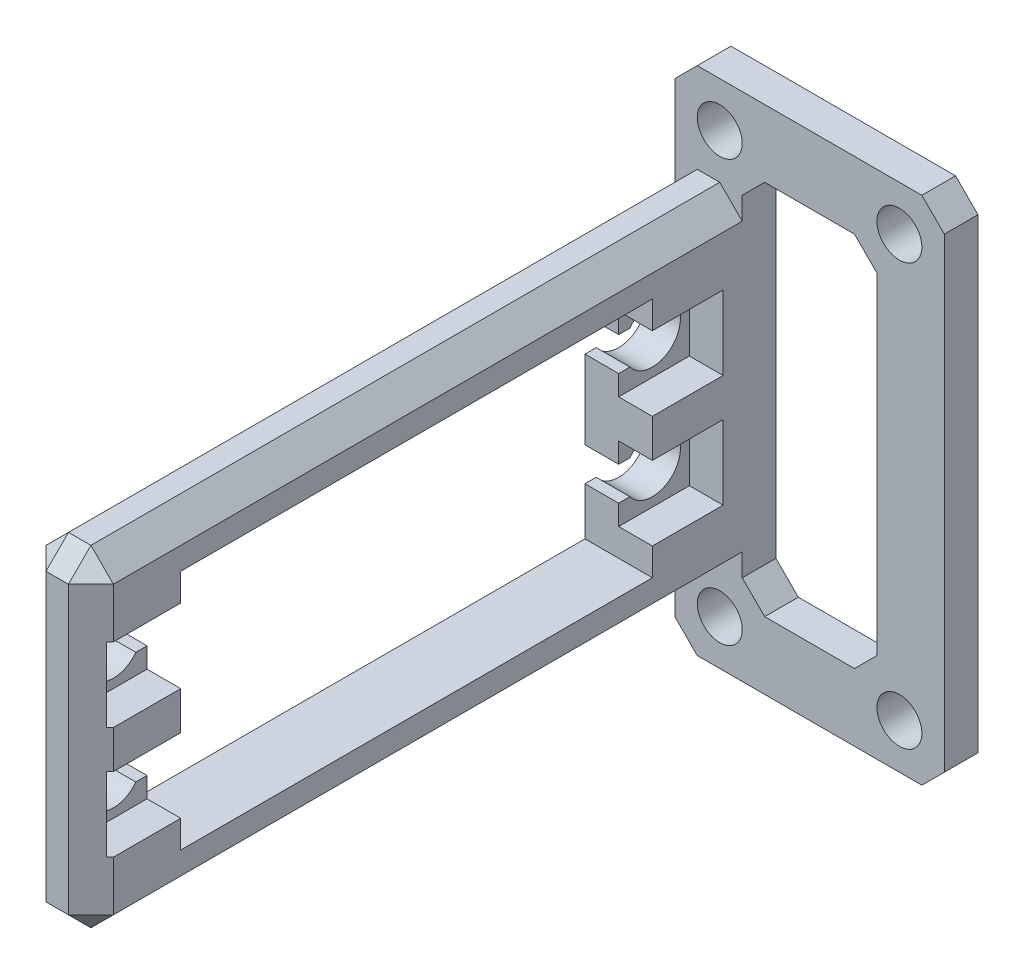
from build123d import *

# Parameters (mm, degrees)
SKETCH1_W           = 58
SKETCH1_H           = 29.5
BOSS_EXTRUDE1_DEPTH = 6
SKETCH2_W           = 6.6
SKETCH2_H           = 6.6
CUT_EXTRUDE1_DEPTH  = 3
SKETCH3_W           = 24
SKETCH3_H           = 45.5
SKETCH3_R           = 2
SKETCH3_W_2         = 12
SKETCH3_H_2         = 33.5
BOSS_EXTRUDE2_DEPTH = 3
CHAMFER5_SIZE       = 2
CHAMFER6_SIZE       = 2
CHAMFER7_SIZE       = 2


with BuildPart() as part:
    # Sketch1 → Boss-Extrude1 (new body)
    with BuildSketch(Plane(origin=(0, 0, 0), x_dir=(0, 0, -1), z_dir=(1, 0, 0))):
        with Locations((-9.508456449, 0.450525737)):
            Rectangle(SKETCH1_W, SKETCH1_H)
        with BuildLine():
            Line((-31.508456449, 6.950525737), (-30.508456449, 6.950525737))
            Line((-30.508456449, 6.950525737), (-30.508456449, 11.200525737))
            Line((-30.508456449, 11.200525737), (11.491543551, 11.200525737))
            Line((11.491543551, 11.200525737), (11.491543551, 6.950525737))
            Line((11.491543551, 6.950525737), (12.491543551, 6.950525737))
            ThreePointArc((12.491543551, 6.950525737), (16.991543551, 5.450525737), (12.491543551, 3.950525737))
            Line((12.491543551, 3.950525737), (11.491543551, 3.950525737))
            Line((11.491543551, 3.950525737), (11.491543551, -3.049474263))
            Line((11.491543551, -3.049474263), (12.491543551, -3.049474263))
            ThreePointArc((12.491543551, -3.049474263), (16.991543551, -4.549474263), (12.491543551, -6.049474263))
            Line((12.491543551, -6.049474263), (11.491543551, -6.049474263))
            Line((11.491543551, -6.049474263), (11.491543551, -10.299474263))
            Line((11.491543551, -10.299474263), (-30.508456449, -10.299474263))
            Line((-30.508456449, -10.299474263), (-30.508456449, -6.049474263))
            Line((-30.508456449, -6.049474263), (-31.508456449, -6.049474263))
            ThreePointArc((-31.508456449, -6.049474263), (-36.008456449, -4.549474263), (-31.508456449, -3.049474263))
            Line((-31.508456449, -3.049474263), (-30.508456449, -3.049474263))
            Line((-30.508456449, -3.049474263), (-30.508456449, 3.950525737))
            Line((-30.508456449, 3.950525737), (-31.508456449, 3.950525737))
            ThreePointArc((-31.508456449, 3.950525737), (-36.008456449, 5.450525737), (-31.508456449, 6.950525737))
        make_face(mode=Mode.SUBTRACT)
    extrude(amount=BOSS_EXTRUDE1_DEPTH)

    # Sketch2 → Cut-Extrude1 (cut)
    with BuildSketch(Plane(origin=(6, 0, 0), x_dir=(0, 0, -1), z_dir=(1, 0, 0))):
        with Locations((-33.508456449, 5.450525737)):
            Rectangle(SKETCH2_W, SKETCH2_H)
        with Locations((14.491543551, 5.450525737)):
            Rectangle(SKETCH2_W, SKETCH2_H)
        with Locations((-33.508456449, -4.549474263)):
            Rectangle(SKETCH2_W, SKETCH2_H)
        with Locations((14.491543551, -4.549474263)):
            Rectangle(SKETCH2_W, SKETCH2_H)
    extrude(amount=-CUT_EXTRUDE1_DEPTH, mode=Mode.SUBTRACT)

    # Sketch3 → Boss-Extrude2 (add)
    with BuildSketch(Plane(origin=(0, 0, -19.491543551), x_dir=(-1, 0, 0), z_dir=(0, 0, -1))):
        with Locations((-12, 0.450525737)):
            Rectangle(SKETCH3_W, SKETCH3_H)
        with Locations(Location((-4, 19.200525737, 0), (0, 0, 90))):
            Circle(SKETCH3_R, mode=Mode.SUBTRACT)
        with Locations(Location((-20, 19.200525737, 0), (0, 0, 270))):
            Circle(SKETCH3_R, mode=Mode.SUBTRACT)
        with Locations(Location((-20, -18.299474263, 0), (0, 0, 90))):
            Circle(SKETCH3_R, mode=Mode.SUBTRACT)
        with Locations(Location((-4, -18.299474263, 0), (0, 0, 270))):
            Circle(SKETCH3_R, mode=Mode.SUBTRACT)
        with Locations((-12, 0.450525737)):
            Rectangle(SKETCH3_W_2, SKETCH3_H_2, mode=Mode.SUBTRACT)
    extrude(amount=BOSS_EXTRUDE2_DEPTH)

    # Chamfer5
    chamfer5_edges = [part.edges().sort_by_distance(p)[0] for p in [
        (6, 17.200525737, -20.991543551),
        (18, 17.200525737, -20.991543551),
        (18, -16.299474263, -20.991543551),
        (6, -16.299474263, -20.991543551),
    ]]
    chamfer(chamfer5_edges, length=CHAMFER5_SIZE)

    # Chamfer6
    chamfer6_edges = [part.edges().sort_by_distance(p)[0] for p in [
        (24, -22.299474263, -20.991543551),
        (0, -22.299474263, -20.991543551),
        (0, 23.200525737, -20.991543551),
        (24, 23.200525737, -20.991543551),
    ]]
    chamfer(chamfer6_edges, length=CHAMFER6_SIZE)

    # Chamfer7
    # the kernel refuses this chamfer: 2 mm, written as the material it takes off along each edge
    with BuildSketch(Plane(origin=(4.666666667, 13.867192404, 37.175123115), x_dir=(0.7071067811865474, -0.7071067811865477, 0), z_dir=(0.577350269189626, 0.5773502691896257, 0.5773502691896257)), Plane(origin=(1.333333333, 13.867192404, 37.175123115), x_dir=(0.7071067811865477, 0.7071067811865474, 0), z_dir=(-0.5773502691896256, 0.5773502691896258, 0.5773502691896258))) as chamfer7_piece_1:
        Polygon((-1.414213562, 0.816496581), (1.414213562, 0.816496581), (0, -1.632993162), align=None)
    extrude(amount=2.540341184, mode=Mode.SUBTRACT)
    with BuildSketch(Plane(origin=(4.666666667, -12.966140929, 37.175123115), x_dir=(0.7071067811865474, 0.7071067811865477, 0), z_dir=(0.577350269189626, -0.5773502691896257, 0.5773502691896257)), Plane(origin=(1.333333333, -12.966140929, 37.175123115), x_dir=(0.7071067811865477, -0.7071067811865474, 0), z_dir=(-0.5773502691896256, -0.5773502691896258, 0.5773502691896258))) as chamfer7_piece_2:
        Polygon((-1.414213562, -0.816496581), (1.414213562, -0.816496581), (0, 1.632993162), align=None)
    extrude(amount=2.540341184, mode=Mode.SUBTRACT)
    with BuildSketch(Plane(origin=(6, 15.200525737, 43.651822425), x_dir=(-0.9996219169112968, 0.027495876610586494, 0), z_dir=(0, 0, -1)), Plane(origin=(6, -14.299474263, -19.491543551), x_dir=(-0.9996219169112968, -0.027495876610586494, 0), z_dir=(0, 0, 1)), Plane(origin=(0, -14.299474263, -19.491543551), x_dir=(-0.027495876610586795, 0.9996219169112968, 0), z_dir=(0, 0, 1)), Plane(origin=(0, 15.200525737, 43.651822425), x_dir=(-0.027495876610586365, -0.9996219169112968, 0), z_dir=(0, 0, -1))) as chamfer7_piece_3:
        Polygon((CHAMFER7_SIZE * 0.999621916911, -CHAMFER7_SIZE * 0.0274958766106), (-CHAMFER7_SIZE * 0.0274958766106, -CHAMFER7_SIZE * 0.999621916911), (0, 0), align=None)
    extrude(amount=63.143365976, mode=Mode.SUBTRACT)
    with BuildSketch(Plane(origin=(6, -19.442840238, 38.508456449), x_dir=(-0.9996219169112968, 0, 0.02749587661058563), z_dir=(0, 1, 0)), Plane(origin=(0, -19.442840238, 38.508456449), x_dir=(-0.02749587661058639, 0, -0.9996219169112968), z_dir=(0, 1, 0))) as chamfer7_piece_4:
        Polygon((CHAMFER7_SIZE * 0.999621916911, -CHAMFER7_SIZE * 0.0274958766106), (-CHAMFER7_SIZE * 0.0274958766106, -CHAMFER7_SIZE * 0.999621916911), (0, 0), align=None)
    extrude(amount=39.786731952, mode=Mode.SUBTRACT)
    with BuildSketch(Plane(origin=(-5.143365976, -14.299474263, 38.508456449), x_dir=(0, -0.02749587661058651, -0.9996219169112968), z_dir=(1, 0, 0))) as chamfer7_piece_5:
        Polygon((CHAMFER7_SIZE * 0.999621916911, CHAMFER7_SIZE * 0.0274958766106), (-CHAMFER7_SIZE * 0.0274958766106, CHAMFER7_SIZE * 0.999621916911), (0, 0), align=None)
    extrude(amount=16.286731952, mode=Mode.SUBTRACT)
    with BuildSketch(Plane(origin=(-5.143365976, 15.200525737, 38.508456449), x_dir=(0, 0.02749587661058651, -0.9996219169112968), z_dir=(1, 0, 0))) as chamfer7_piece_6:
        Polygon((CHAMFER7_SIZE * 0.999621916911, -CHAMFER7_SIZE * 0.0274958766106), (-CHAMFER7_SIZE * 0.0274958766106, -CHAMFER7_SIZE * 0.999621916911), (0, 0), align=None)
    extrude(amount=16.286731952, mode=Mode.SUBTRACT)


solid = part.part
